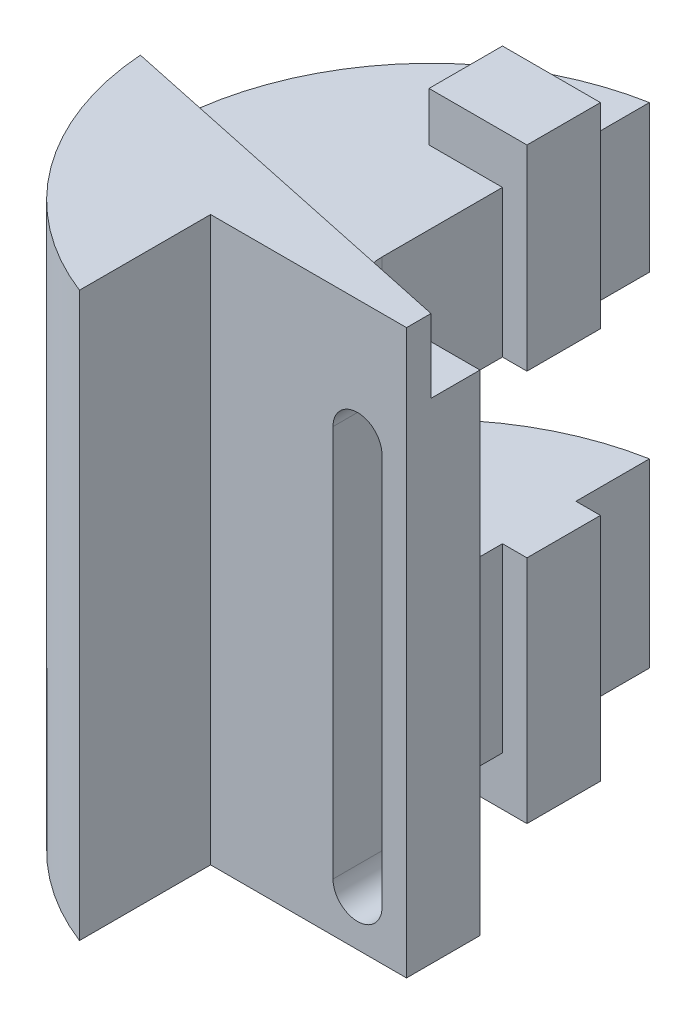
from build123d import *

# Parameters (mm, degrees)
BOSS_EXTRUDE1_DEPTH = 100
CUT_EXTRUDE1_DEPTH  = 100
SKETCH4_W           = 40
SKETCH4_H           = 33
CUT_EXTRUDE2_DEPTH  = 100
BOSS_EXTRUDE2_DEPTH = 15
SKETCH6_W           = 20
SKETCH6_H           = 15
BOSS_EXTRUDE3_DEPTH = 10
SKETCH7_W           = 20
SKETCH7_H           = 15
BOSS_EXTRUDE4_DEPTH = 10


with BuildPart() as part:
    # Sketch1 → Boss-Extrude1 (new body)
    with BuildSketch(Plane(origin=(0, 0, 0), x_dir=(1, 0, 0), z_dir=(0, 1, 0))):
        with BuildLine():
            Line((-10, 0), (-10, 24.591666031))
            Line((-10, 24.591666031), (-5, 24.591666031))
            Line((-5, 24.591666031), (-5, 39.591666031))
            Line((-5, 39.591666031), (-10, 39.591666031))
            Line((-10, 39.591666031), (-10, 54.591666031))
            ThreePointArc((-10, 54.591666031), (-55.256322222, 5.195079839), (-20, -51.771130952))
            Line((-20, -51.771130952), (-20, -25))
            Line((-20, -25), (20, -25))
            Line((20, -25), (20, -10))
            Line((20, -10), (0, -10))
            ThreePointArc((0, -10), (-7.071067812, -7.071067812), (-10, 0))
        make_face()
    extrude(amount=BOSS_EXTRUDE1_DEPTH)

    # Sketch2 → Cut-Extrude1 (cut)
    with BuildSketch(Plane(origin=(0, 0, 10), x_dir=(-1, 0, 0), z_dir=(0, 0, -1))):
        with BuildLine():
            Line((-4.99535342, 90), (-4.99535342, 10))
            ThreePointArc((-4.99535342, 10), (-9.99535342, 5), (-14.99535342, 10))
            Line((-14.99535342, 10), (-14.99535342, 90))
            ThreePointArc((-14.99535342, 90), (-9.99535342, 95), (-4.99535342, 90))
        make_face()
    extrude(amount=-CUT_EXTRUDE1_DEPTH, mode=Mode.SUBTRACT)

    # Sketch4 → Cut-Extrude2 (cut)
    with BuildSketch(Plane(origin=(-5, 0, 0), x_dir=(0, 0, -1), z_dir=(1, 0, 0))):
        with Locations((34.591666031, 53.5)):
            Rectangle(SKETCH4_W, SKETCH4_H)
    extrude(amount=-CUT_EXTRUDE2_DEPTH, mode=Mode.SUBTRACT)

    # Sketch5 → Boss-Extrude2 (add)
    with BuildSketch(Plane(origin=(0, 100, 0), x_dir=(1, 0, 0), z_dir=(0, 1, 0))):
        with BuildLine():
            Line((20, -20), (-55.356937984, -3.982388364))
            ThreePointArc((-55.356937984, -3.982388364), (-44.616230288, -33.009725763), (-20, -51.771130952))
            Line((-20, -51.771130952), (-20, -25))
            Line((-20, -25), (20, -25))
            Line((20, -25), (20, -20))
        make_face()
    extrude(amount=BOSS_EXTRUDE2_DEPTH)

    # Sketch6 → Boss-Extrude3 (add)
    with BuildSketch(Plane(origin=(0, 100, 0), x_dir=(1, 0, 0), z_dir=(0, 1, 0))):
        with Locations((-15, 32.091666031)):
            Rectangle(SKETCH6_W, SKETCH6_H)
    extrude(amount=BOSS_EXTRUDE3_DEPTH)

    # Sketch7 → Boss-Extrude4 (add)
    with BuildSketch(Plane.XZ):
        with Locations((-15, -32.091666031)):
            Rectangle(SKETCH7_W, SKETCH7_H)
    extrude(amount=BOSS_EXTRUDE4_DEPTH)


solid = part.part
